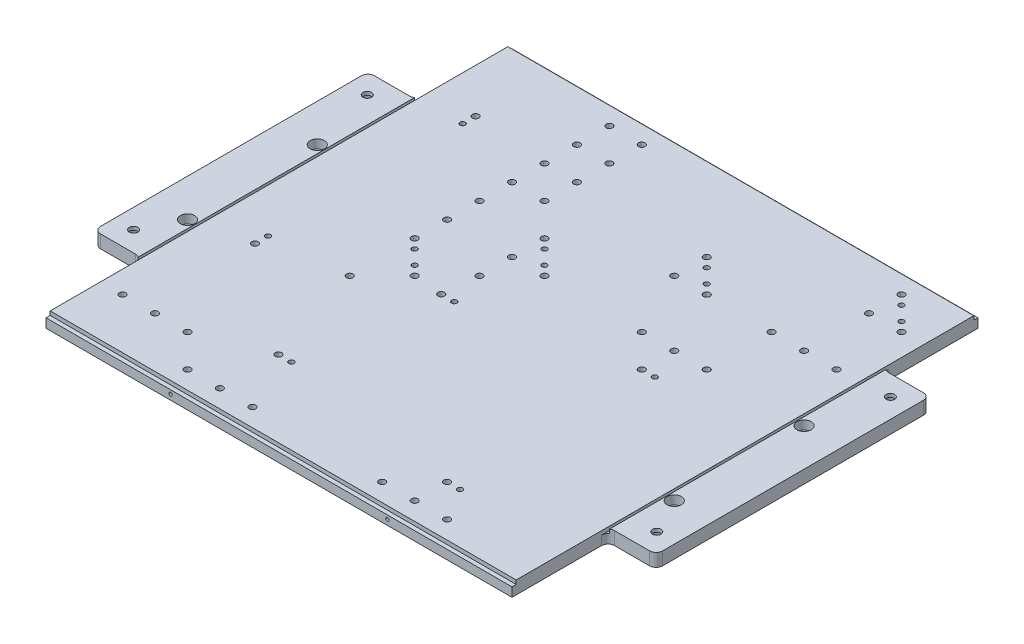
from build123d import *

# Parameters (mm, degrees)
SKETCH_1_W                  = 411
SKETCH_1_H                  = 387
EXTRUDE_1_DEPTH             = 10
HOLE_WIZARD_M6_1_D          = 5
PATTERN_LINEAR_1_COUNT      = 16
PATTERN_LINEAR_1_PITCH      = 25
PATTERN_LINEAR_1_COUNT_DIR2 = 15
PATTERN_LINEAR_1_PITCH_DIR2 = 25
CUT_EXTRUDE_1_DEPTH         = 1521.246679475
SKETCH_7_W                  = 359.002103073
SKETCH_7_H                  = 10
CUT_EXTRUDE_2_DEPTH         = 2
SKETCH_6_W                  = 37
SKETCH_6_H                  = 211
EXTRUDE_2_DEPTH             = 10
HOLE_WIZARD_4_AT_2_COUNT    = 2
HOLE_WIZARD_4_AT_2_PITCH    = 180
HOLE_WIZARD_2_D             = 6.6
HOLE_WIZARD_2_CBORE_D       = 11
HOLE_WIZARD_2_CBORE_DEPTH   = 6.8
FILLET_1_R                  = 5
SKETCH_13_W                 = 2
SKETCH_13_H                 = 221
CUT_EXTRUDE_3_DEPTH         = 3
MIRROR_START                = -18.243069244
MIRROR_1_OUTLINE_R          = 5.5
MIRROR_1_DEPTH              = 10
MIRROR_1_2_OUTLINE_W        = 2
MIRROR_1_2_OUTLINE_H        = 211
MIRROR_1_2_DEPTH            = 7
MIRROR_1_3_OUTLINE_R        = 5.5
MIRROR_1_3_OUTLINE_R_2      = 3.3
MIRROR_1_3_DEPTH            = 3.2
MIRROR_START_2              = -10.943069244
MIRROR_1_4_OUTLINE_R        = 5.5
MIRROR_1_4_OUTLINE_R_2      = 3.3
MIRROR_1_4_DEPTH            = 2.7
FILLET_2_R                  = 5
MM_1_D                      = 4
MM_1_DEPTH                  = 5
MM_1_TIP                    = 1.201721238
SKETCH_21_W                 = 359.002103073
SKETCH_21_H                 = 3.2
CUT_EXTRUDE_4_DEPTH         = 3
SKETCH_27_W                 = 41.507611356
SKETCH_27_H                 = 16.91050833
SKETCH_27_W_2               = 59.033047261
SKETCH_27_W_3               = 46.898939792
SKETCH_27_H_2               = 20.423731845
SKETCH_27_W_4               = 48.421635053
SKETCH_27_H_3               = 17.145848956
SKETCH_27_W_5               = 188.400683749
SKETCH_27_H_4               = 13.273709609
SKETCH_27_W_6               = 112.684721901
SKETCH_27_H_5               = 11.860005057
SKETCH_27_W_7               = 13.604123448
SKETCH_27_H_6               = 18.487654942
SKETCH_27_W_8               = 13.618797305
SKETCH_27_W_9               = 39.068251954
SKETCH_27_H_7               = 62.788262068
SKETCH_27_W_10              = 91.658386013
SKETCH_27_H_8               = 38.021780919
SKETCH_27_W_11              = 15.139084427
SKETCH_27_H_9               = 88.931751365
SKETCH_27_H_10              = 19.101334579
SKETCH_27_W_12              = 12.872846144
SKETCH_27_H_11              = 37.69112722
SKETCH_27_W_13              = 25.127795673
SKETCH_27_H_12              = 295.469278641
SKETCH_27_W_14              = 11.542629068
SKETCH_27_H_13              = 11.212839666
SKETCH_27_W_15              = 13.955770488
SKETCH_27_H_14              = 189.938608596
SKETCH_27_W_16              = 81.343958049
SKETCH_27_H_15              = 11.636862104
SKETCH_27_W_17              = 41.419277235
SKETCH_27_H_16              = 36.742907224
SKETCH_27_W_18              = 39.735429832
SKETCH_27_H_17              = 11.559156978
EXTRUDE_3_DEPTH             = 10
SKETCH_28_W                 = 42.000178388
SKETCH_28_H                 = 16.704616404
SKETCH_28_W_2               = 21.000089194
SKETCH_28_H_2               = 212.387265713
EXTRUDE_4_DEPTH             = 10
SKETCH_29_W                 = 13.644321788
SKETCH_29_H                 = 12.474808491
SKETCH_29_W_2               = 8.284490797
SKETCH_29_H_2               = 7.647222274
SKETCH_29_W_3               = 63.515460672
SKETCH_29_H_3               = 13.700690012
SKETCH_29_W_4               = 63.924431751
SKETCH_29_H_4               = 15.793094903
SKETCH_29_W_5               = 62.420327474
SKETCH_29_W_6               = 60.418413128
SKETCH_29_H_5               = 15.604334822
SKETCH_29_W_7               = 60.104489011
SKETCH_29_W_8               = 13.682181528
SKETCH_29_H_6               = 111.610747838
EXTRUDE_7_DEPTH             = 10
SKETCH_30_W                 = 19.090990176
SKETCH_30_H                 = 209.523617186
SKETCH_30_W_2               = 138.409678779
SKETCH_30_H_2               = 117.409589585
SKETCH_30_W_3               = 63.000267582
SKETCH_30_H_3               = 44.535697431
SKETCH_30_W_4               = 12.409143615
SKETCH_30_H_4               = 11.93186886
SKETCH_30_W_5               = 43.846173029
SKETCH_30_H_5               = 14.820702415
EXTRUDE_9_DEPTH             = 10
HOLE_WIZARD_M6_2_D          = 5
MM_5_D                      = 4
MM_5_DEPTH                  = 5
MM_5_TIP                    = 1.201721238


# Read off the part's stored shape, not the designer's step: 镜向1, M3 螺纹孔, M3 螺纹孔
with BuildPart() as part:
    # 草图1 → 凸台-拉伸1 (new body)
    with BuildSketch(Plane(origin=(-1122.052953715, -8.243069244, -45.053190539), x_dir=(1, 0, 0), z_dir=(0, 1, 0))):
        with Locations((-103.248130707, -365.224508868)):
            Rectangle(SKETCH_1_W, SKETCH_1_H)
    extrude(amount=-EXTRUDE_1_DEPTH)

    # M6 螺纹孔1 (through all)
    with Locations(Plane(origin=(-1037.801084421, -18.243069244, 494.67131833), x_dir=(0, 0, -1), z_dir=(0, -1, 0))):
        with Locations((0, 0)):
            hole_wizard_m6_1 = Hole(HOLE_WIZARD_M6_1_D / 2)

    # 阵列(线性)1: Hole Wizard M6 _1 16 × 15
    with Locations(*[(-i * PATTERN_LINEAR_1_PITCH, 0, -j * PATTERN_LINEAR_1_PITCH_DIR2) for i in range(PATTERN_LINEAR_1_COUNT) for j in range(PATTERN_LINEAR_1_COUNT_DIR2) if (i, j) != (0, 0)]):
        add(hole_wizard_m6_1, mode=Mode.SUBTRACT)

    # 草图5 → 切除-拉伸1 (cut, through all)
    with BuildSketch(Plane(origin=(0, -8.243069244, 0), x_dir=(1, 0, 0), z_dir=(0, 1, 0))):
        Polygon((-1045.801084421, -511.67131833), (-1045.801084421, -152.67131833), (-1404.803187494, -152.67131833), (-1404.803187494, -511.67131833), (-1404.803187494, -513.67131833), (-1430.801084421, -513.67131833), (-1430.801084421, -126.67131833), (-1019.801084421, -126.67131833), (-1019.801084421, -513.67131833), (-1045.801084421, -513.67131833), align=None)
    extrude(amount=-CUT_EXTRUDE_1_DEPTH, mode=Mode.SUBTRACT)

    # 草图7 → 切除-拉伸2 (cut)
    with BuildSketch(Plane.XY.offset(513.67131833)):
        with Locations((-1225.302135958, -13.243069244)):
            Rectangle(SKETCH_7_W, SKETCH_7_H)
    extrude(amount=-CUT_EXTRUDE_2_DEPTH, mode=Mode.SUBTRACT)

    # 草图6 → 凸台-拉伸2 (add)
    with BuildSketch(Plane.XZ.offset(18.243069244)):
        with Locations((-1423.303187494, 332.17131833)):
            Rectangle(SKETCH_6_W, SKETCH_6_H)
    extrude(amount=-EXTRUDE_2_DEPTH)

    # 草图10 → 打孔尺寸(%根据)内六角圆柱头螺钉的类型4 (revolve, cut)
    with BuildSketch(Plane(origin=(-1426.803187494, -18.243069244, 242.17131833), x_dir=(0, 0, -1), z_dir=(1, 0, 0))):
        Polygon((0, 0), (0, 21.732840043), (3.3, 19.75), (3.3, 7.3), (5.5, 7.3), (5.5, 0), align=None)
    hole_wizard_4 = revolve(axis=Axis((-1426.803187494, -24.593069244, 242.17131833), (0, 1, 0)), mode=Mode.SUBTRACT)

    # 打孔尺寸(%根据)内六角圆柱头螺钉的类型4 at 2: 打孔尺寸(%根据)内六角圆柱头螺钉的类型4 ×2
    with Locations(*[(0, 0, i * HOLE_WIZARD_4_AT_2_PITCH) for i in range(1, HOLE_WIZARD_4_AT_2_COUNT)]):
        add(hole_wizard_4, mode=Mode.SUBTRACT)

    # 打孔尺寸(%根据)内六角圆柱头螺钉的类型2 (through all)
    with Locations(Plane(origin=(-1412.801084421, -8.243069244, 294.67131833), x_dir=(0, 0, 1), z_dir=(0, 1, 0))):
        with Locations((0, 0), (100, 0)):
            CounterBoreHole(HOLE_WIZARD_2_D / 2, HOLE_WIZARD_2_CBORE_D / 2, HOLE_WIZARD_2_CBORE_DEPTH)

    # 圆角1
    fillet_1_edges = [part.edges().sort_by_distance(p)[0] for p in [
        (-1441.803187494, -13.243069244, 437.67131833),
        (-1441.803187494, -13.243069244, 226.67131833),
        (-1404.803187494, -13.243069244, 226.67131833),
        (-1404.803187494, -13.243069244, 437.67131833),
    ]]
    fillet(fillet_1_edges, radius=FILLET_1_R)

    # 草图13 → 切除-拉伸3 (cut)
    with BuildSketch(Plane(origin=(0, -8.243069244, 0), x_dir=(1, 0, 0), z_dir=(0, 1, 0))):
        with Locations((-1405.803187494, -332.17131833)):
            Rectangle(SKETCH_13_W, SKETCH_13_H)
    extrude(amount=-CUT_EXTRUDE_3_DEPTH, mode=Mode.SUBTRACT)



with BuildPart() as body_2:
    # 镜向1 outline → 镜向1 (new body)
    with BuildSketch(Plane(origin=(0, 0, 0), x_dir=(1, 0, 0), z_dir=(0, 1, 0)).offset(MIRROR_START)):
        with BuildLine():
            Line((-1043.801084421, -437.67131833), (-1013.801084421, -437.67131833))
            ThreePointArc((-1013.801084421, -437.67131833), (-1010.265550515, -436.206852236), (-1008.801084421, -432.67131833))
            Line((-1008.801084421, -432.67131833), (-1008.801084421, -231.67131833))
            ThreePointArc((-1008.801084421, -231.67131833), (-1010.265550515, -228.135784424), (-1013.801084421, -226.67131833))
            Line((-1013.801084421, -226.67131833), (-1043.801084421, -226.67131833))
            Line((-1043.801084421, -226.67131833), (-1043.801084421, -437.67131833))
        make_face()
        with Locations((-1037.803187494, -394.67131833)):
            Circle(MIRROR_1_OUTLINE_R, mode=Mode.SUBTRACT)
        with Locations((-1023.801084421, -422.17131833)):
            Circle(MIRROR_1_OUTLINE_R, mode=Mode.SUBTRACT)
        with Locations((-1037.803187494, -294.67131833)):
            Circle(MIRROR_1_OUTLINE_R, mode=Mode.SUBTRACT)
        with Locations((-1023.801084421, -242.17131833)):
            Circle(MIRROR_1_OUTLINE_R, mode=Mode.SUBTRACT)
    extrude(amount=MIRROR_1_DEPTH)


with BuildPart() as part_1:
    add(part.part)

    add(body_2.part)  # Mirror 1 2 merges body 2
    # Mirror 1 2 outline → Mirror 1 2 (add)
    with BuildSketch(Plane(origin=(0, 0, 0), x_dir=(1, 0, 0), z_dir=(0, 1, 0)).offset(MIRROR_START)):
        with Locations((-1044.801084421, -332.17131833)):
            Rectangle(MIRROR_1_2_OUTLINE_W, MIRROR_1_2_OUTLINE_H)
    extrude(amount=MIRROR_1_2_DEPTH)

    # Mirror 1 3 outline → Mirror 1 3 (add)
    # profile 1 of 2: a face of its own
    with BuildSketch(Plane(origin=(0, 0, 0), x_dir=(1, 0, 0), z_dir=(0, 1, 0)).offset(MIRROR_START)):
        with Locations((-1037.803187494, -394.67131833)):
            Circle(MIRROR_1_3_OUTLINE_R)
        with Locations((-1037.803187494, -394.67131833)):
            Circle(MIRROR_1_3_OUTLINE_R_2, mode=Mode.SUBTRACT)
    # profile 2 of 2: a face of its own
    with BuildSketch(Plane(origin=(0, 0, 0), x_dir=(1, 0, 0), z_dir=(0, 1, 0)).offset(MIRROR_START)):
        with Locations((-1037.803187494, -294.67131833)):
            Circle(MIRROR_1_3_OUTLINE_R)
        with Locations((-1037.803187494, -294.67131833)):
            Circle(MIRROR_1_3_OUTLINE_R_2, mode=Mode.SUBTRACT)
    extrude(amount=MIRROR_1_3_DEPTH)

    # Mirror 1 4 outline → Mirror 1 4 (add)
    # profile 1 of 2: a face of its own
    with BuildSketch(Plane(origin=(0, 0, 0), x_dir=(1, 0, 0), z_dir=(0, 1, 0)).offset(MIRROR_START_2)):
        with Locations((-1023.801084421, -422.17131833)):
            Circle(MIRROR_1_4_OUTLINE_R)
        with Locations((-1023.801084421, -422.17131833)):
            Circle(MIRROR_1_4_OUTLINE_R_2, mode=Mode.SUBTRACT)
    # profile 2 of 2: a face of its own
    with BuildSketch(Plane(origin=(0, 0, 0), x_dir=(1, 0, 0), z_dir=(0, 1, 0)).offset(MIRROR_START_2)):
        with Locations((-1023.801084421, -242.17131833)):
            Circle(MIRROR_1_4_OUTLINE_R)
        with Locations((-1023.801084421, -242.17131833)):
            Circle(MIRROR_1_4_OUTLINE_R_2, mode=Mode.SUBTRACT)
    extrude(amount=MIRROR_1_4_DEPTH)

    # 圆角2
    # the kernel refuses this fillet: 5 mm, written as the material it adds along each edge
    with BuildSketch(Plane(origin=(-1045.801084421, -18.243069244, 437.67131833), x_dir=(-6.125446816440671e-11, 0, 1.0), z_dir=(0, 1, 0))) as fillet_2_piece_1_section:
        with BuildLine():
            CenterArc((FILLET_2_R, FILLET_2_R), FILLET_2_R, 180.000000004, 90)
            Line((-FILLET_2_R * 6.12544681607e-11, FILLET_2_R), (0, 0))
            Line((0, 0), (FILLET_2_R, 0))
        make_face()
    fillet_2_piece_1 = extrude(amount=7, mode=Mode.PRIVATE)
    fillet_2_piece_1 = split(fillet_2_piece_1, bisect_by=Plane(origin=(-1043.801084421, -14.743069244, 439.02909794), z_dir=(-1, 0, 0)), keep=Keep.TOP, mode=Mode.PRIVATE)
    add(fillet_2_piece_1)
    with BuildSketch(Plane(origin=(-1045.801084421, -18.243069244, 437.67131833), x_dir=(-6.125446816440671e-11, 0, 1.0), z_dir=(0, 1, 0))) as fillet_2_piece_2_section:
        with BuildLine():
            CenterArc((FILLET_2_R, FILLET_2_R), FILLET_2_R, 180.000000004, 90)
            Line((-FILLET_2_R * 6.12544681607e-11, FILLET_2_R), (0, 0))
            Line((0, 0), (FILLET_2_R, 0))
        make_face()
    fillet_2_piece_2 = extrude(amount=7, mode=Mode.PRIVATE)
    fillet_2_piece_2 = split(fillet_2_piece_2, bisect_by=Plane(origin=(-1043.801084421, -14.743069244, 437.883205802), z_dir=(1, 0, 0)), keep=Keep.TOP, mode=Mode.PRIVATE)
    add(fillet_2_piece_2)
    with BuildSketch(Plane(origin=(-1045.801084421, -18.243069244, 437.67131833), x_dir=(-6.125446816440671e-11, 0, 1.0), z_dir=(0, 1, 0))) as fillet_2_piece_3_section:
        with BuildLine():
            CenterArc((FILLET_2_R, FILLET_2_R), FILLET_2_R, 180.000000004, 90)
            Line((-FILLET_2_R * 6.12544681607e-11, FILLET_2_R), (0, 0))
            Line((0, 0), (FILLET_2_R, 0))
        make_face()
    fillet_2_piece_3 = extrude(amount=19.5, mode=Mode.PRIVATE)
    fillet_2_piece_3 = split(fillet_2_piece_3, bisect_by=Plane(origin=(-1042.884026141, -8.243069244, 437.883205802), z_dir=(0, -1, 0)), keep=Keep.TOP, mode=Mode.PRIVATE)
    fillet_2_piece_3 = split(fillet_2_piece_3, bisect_by=Plane(origin=(-1042.884026141, -11.243069244, 437.883205802), z_dir=(0, 1, 0)), keep=Keep.TOP, mode=Mode.PRIVATE)
    fillet_2_piece_3 = split(fillet_2_piece_3, bisect_by=Plane(origin=(-1043.801084421, -9.743069244, 437.883205802), z_dir=(1, 0, 0)), keep=Keep.TOP, mode=Mode.PRIVATE)
    add(fillet_2_piece_3)
    with BuildSketch(Plane(origin=(-1045.801084421, -18.243069244, 226.67131833), x_dir=(-6.125446816440636e-11, 0, -1.0), z_dir=(0, 1, 0))) as fillet_2_piece_4_section:
        with BuildLine():
            CenterArc((FILLET_2_R, -FILLET_2_R), FILLET_2_R, 89.999999996, 90)
            Line((-FILLET_2_R * 6.12487838188e-11, -FILLET_2_R), (0, 0))
            Line((0, 0), (FILLET_2_R, 0))
        make_face()
    fillet_2_piece_4 = extrude(amount=7, mode=Mode.PRIVATE)
    fillet_2_piece_4 = split(fillet_2_piece_4, bisect_by=Plane(origin=(-1043.801084421, -14.743069244, 225.31353872), z_dir=(-1, 0, 0)), keep=Keep.TOP, mode=Mode.PRIVATE)
    add(fillet_2_piece_4)
    with BuildSketch(Plane(origin=(-1045.801084421, -18.243069244, 226.67131833), x_dir=(-6.125446816440636e-11, 0, -1.0), z_dir=(0, 1, 0))) as fillet_2_piece_5_section:
        with BuildLine():
            CenterArc((FILLET_2_R, -FILLET_2_R), FILLET_2_R, 89.999999996, 90)
            Line((-FILLET_2_R * 6.12487838188e-11, -FILLET_2_R), (0, 0))
            Line((0, 0), (FILLET_2_R, 0))
        make_face()
    fillet_2_piece_5 = extrude(amount=7, mode=Mode.PRIVATE)
    fillet_2_piece_5 = split(fillet_2_piece_5, bisect_by=Plane(origin=(-1043.801084421, -14.743069244, 226.459430858), z_dir=(1, 0, 0)), keep=Keep.TOP, mode=Mode.PRIVATE)
    add(fillet_2_piece_5)
    with BuildSketch(Plane(origin=(-1045.801084421, -18.243069244, 226.67131833), x_dir=(-6.125446816440636e-11, 0, -1.0), z_dir=(0, 1, 0))) as fillet_2_piece_6_section:
        with BuildLine():
            CenterArc((FILLET_2_R, -FILLET_2_R), FILLET_2_R, 89.999999996, 90)
            Line((-FILLET_2_R * 6.12487838188e-11, -FILLET_2_R), (0, 0))
            Line((0, 0), (FILLET_2_R, 0))
        make_face()
    fillet_2_piece_6 = extrude(amount=19.5, mode=Mode.PRIVATE)
    fillet_2_piece_6 = split(fillet_2_piece_6, bisect_by=Plane(origin=(-1042.884026141, -8.243069244, 226.459430858), z_dir=(0, -1, 0)), keep=Keep.TOP, mode=Mode.PRIVATE)
    fillet_2_piece_6 = split(fillet_2_piece_6, bisect_by=Plane(origin=(-1042.884026141, -11.243069244, 226.459430858), z_dir=(0, 1, 0)), keep=Keep.TOP, mode=Mode.PRIVATE)
    fillet_2_piece_6 = split(fillet_2_piece_6, bisect_by=Plane(origin=(-1043.801084421, -9.743069244, 226.459430858), z_dir=(1, 0, 0)), keep=Keep.TOP, mode=Mode.PRIVATE)
    add(fillet_2_piece_6)

    # 大小mm 暗销孔1
    with Locations(Plane(origin=(-1080.730016609, -8.243069244, 176.742386142), x_dir=(0, 0, 1), z_dir=(0, 1, 0))):
        with Locations((0, 0), (10.857864376, 10.857864376), (60.857864376, -89.142135624), (50, -100), (110.857864376, -164.142135624), (100, -175), (160.858270185, -214.142541436), (150.000160052, -225.00016005)):
            Hole(MM_1_D / 2, depth=MM_1_DEPTH)
            with Locations((0, 0, -(MM_1_DEPTH + MM_1_TIP / 2))):  # 118° drill point
                Cone(0, MM_1_D / 2, MM_1_TIP, mode=Mode.SUBTRACT)

    # 草图21 → 切除-拉伸4 (cut)
    with BuildSketch(Plane(origin=(0, -8.243069244, 0), x_dir=(1, 0, 0), z_dir=(0, 1, 0))):
        with Locations((-1225.302135958, -154.27131833)):
            Rectangle(SKETCH_21_W, SKETCH_21_H)
        with Locations((-1225.302135958, -510.07131833)):
            Rectangle(SKETCH_21_W, SKETCH_21_H)
    extrude(amount=-CUT_EXTRUDE_4_DEPTH, mode=Mode.SUBTRACT)

    # Hole Wizard M3 outline → Hole Wizard M3 (revolve, cut)
    with BuildSketch(Plane(origin=(-1308.798192024, -14.243069244, 0), x_dir=(1, 0, 0), z_dir=(0, -1, 0))):
        Polygon((1.25, 152.67131833), (1.25, 160.67131833), (0, 161.422394104), (0, 152.67131833), align=None)
    revolve(axis=Axis((-1308.798192024, -14.243069244, 0), (0, 0, 1)), mode=Mode.SUBTRACT)

    # Hole Wizard M3 2 outline → Hole Wizard M3 2 (revolve, cut)
    with BuildSketch(Plane(origin=(-1141.798192024, -14.243069244, 0), x_dir=(1, 0, 0), z_dir=(0, -1, 0))):
        Polygon((1.25, 152.67131833), (1.25, 160.67131833), (0, 161.422394104), (0, 152.67131833), align=None)
    revolve(axis=Axis((-1141.798192024, -14.243069244, 0), (0, 0, 1)), mode=Mode.SUBTRACT)

    # Hole Wizard M3 3 outline → Hole Wizard M3 3 (revolve, cut)
    with BuildSketch(Plane(origin=(-1308.798192024, -14.243069244, 0), x_dir=(1, 0, 0), z_dir=(0, -1, 0))):
        Polygon((0, 502.920242556), (1.25, 503.67131833), (1.25, 511.67131833), (0, 511.67131833), align=None)
    revolve(axis=Axis((-1308.798192024, -14.243069244, 0), (0, 0, 1)), mode=Mode.SUBTRACT)

    # Hole Wizard M3 3 2 outline → Hole Wizard M3 3 2 (revolve, cut)
    with BuildSketch(Plane(origin=(-1141.798192024, -14.243069244, 0), x_dir=(1, 0, 0), z_dir=(0, -1, 0))):
        Polygon((0, 502.920242556), (1.25, 503.67131833), (1.25, 511.67131833), (0, 511.67131833), align=None)
    revolve(axis=Axis((-1141.798192024, -14.243069244, 0), (0, 0, 1)), mode=Mode.SUBTRACT)

    # 草图27 → 凸台-拉伸3 (add, through all)
    with BuildSketch(Plane(origin=(0, -8.243069244, 0), x_dir=(1, 0, 0), z_dir=(0, 1, 0))):
        with Locations((-1199.649282092, -494.994915489)):
            Rectangle(SKETCH_27_W, SKETCH_27_H)
        with Locations((-1079.584672949, -494.994915489)):
            Rectangle(SKETCH_27_W_2, SKETCH_27_H)
        with Locations((-1078.435717972, -289.903916073)):
            Rectangle(SKETCH_27_W_3, SKETCH_27_H_2)
        with Locations((-1196.192270244, -291.542857518)):
            Rectangle(SKETCH_27_W_4, SKETCH_27_H_3)
        with Locations((-1149.186589951, -269.061509581)):
            Rectangle(SKETCH_27_W_5, SKETCH_27_H_4)
        with Locations((-1111.328609027, -219.378743549)):
            Rectangle(SKETCH_27_W_6, SKETCH_27_H_5)
        with Locations((-1137.846545495, -245.017283893)):
            Rectangle(SKETCH_27_W_7, SKETCH_27_H_6)
        with Locations((-1061.795646729, -168.450486538)):
            Rectangle(SKETCH_27_W_8, SKETCH_27_H_5)
        with Locations((-1226.970995264, -193.914615043)):
            Rectangle(SKETCH_27_W_9, SKETCH_27_H_7)
        with Locations((-1150.363077237, -181.531374469)):
            Rectangle(SKETCH_27_W_10, SKETCH_27_H_8)
        with Locations((-1266.269407303, -206.986359692)):
            Rectangle(SKETCH_27_W_11, SKETCH_27_H_9)
        with Locations((-1226.970995264, -241.901568085)):
            Rectangle(SKETCH_27_W_9, SKETCH_27_H_10)
        with Locations((-1289.891778574, -281.270218386)):
            Rectangle(SKETCH_27_W_12, SKETCH_27_H_11)
        with Locations((-1337.252409854, -312.048778062)):
            Rectangle(SKETCH_27_W_13, SKETCH_27_H_12)
        with Locations((-1287.207313057, -319.117980891)):
            Rectangle(SKETCH_27_W_14, SKETCH_27_H_13)
        with Locations((-1239.0327317, -408.480865356)):
            Rectangle(SKETCH_27_W_15, SKETCH_27_H_14)
        with Locations((-1290.987895969, -469.774226773)):
            Rectangle(SKETCH_27_W_16, SKETCH_27_H_15)
        with Locations((-1373.00466654, -434.33970125)):
            Rectangle(SKETCH_27_W_17, SKETCH_27_H_16)
        with Locations((-1373.846590241, -494.545947833)):
            Rectangle(SKETCH_27_W_18, SKETCH_27_H_17)
    extrude(amount=-EXTRUDE_3_DEPTH)

    # 草图28 → 凸台-拉伸4 (add, through all)
    with BuildSketch(Plane(origin=(0, -8.243069244, 0), x_dir=(1, 0, 0), z_dir=(0, 1, 0))):
        with Locations((-1376.359595728, -169.420627076)):
            Rectangle(SKETCH_28_W, SKETCH_28_H)
        with Locations((-1386.859640325, -294.466612731)):
            Rectangle(SKETCH_28_W_2, SKETCH_28_H_2)
    extrude(amount=-EXTRUDE_4_DEPTH)

    # 草图29 → 凸台-拉伸7 (add, through all)
    with BuildSketch(Plane(origin=(0, -8.243069244, 0), x_dir=(1, 0, 0), z_dir=(0, 1, 0))):
        with Locations((-1312.797213292, -345.191502531)):
            Rectangle(SKETCH_29_W, SKETCH_29_H)
        with Locations((-1263.075419887, -344.533272281)):
            Rectangle(SKETCH_29_W_2, SKETCH_29_H_2)
        with Locations((-1287.86164385, -443.714501117)):
            Rectangle(SKETCH_29_W_3, SKETCH_29_H_3)
        with Locations((-1189.293633966, -319.552968558)):
            Rectangle(SKETCH_29_W_4, SKETCH_29_H_4)
        with Locations((-1087.390569234, -319.552968558)):
            Rectangle(SKETCH_29_W_5, SKETCH_29_H_4)
        with Locations((-1187.540624654, -469.686482866)):
            Rectangle(SKETCH_29_W_6, SKETCH_29_H_5)
        with Locations((-1086.232650003, -469.686482866)):
            Rectangle(SKETCH_29_W_7, SKETCH_29_H_5)
        with Locations((-1063.021496261, -394.759472204)):
            Rectangle(SKETCH_29_W_8, SKETCH_29_H_6)
    extrude(amount=-EXTRUDE_7_DEPTH)

    # 草图30 → 凸台-拉伸9 (add, through all)
    with BuildSketch(Plane(origin=(0, -8.243069244, 0), x_dir=(1, 0, 0), z_dir=(0, 1, 0))):
        with Locations((-1362.995902605, -293.512063223)):
            Rectangle(SKETCH_30_W, SKETCH_30_H)
        with Locations((-1151.563186401, -394.45567378)):
            Rectangle(SKETCH_30_W_2, SKETCH_30_H_2)
        with Locations((-1285.200117636, -405.597057874)):
            Rectangle(SKETCH_30_W_3, SKETCH_30_H_3)
        with Locations((-1337.223065867, -493.967460075)):
            Rectangle(SKETCH_30_W_4, SKETCH_30_H_4)
        with Locations((-1275.62307036, -369.929081524)):
            Rectangle(SKETCH_30_W_5, SKETCH_30_H_5)
    extrude(amount=-EXTRUDE_9_DEPTH)

    # M6 螺纹孔2 (through all)
    with Locations(Plane(origin=(-1370.803187494, -8.243069244, 214.67131833), x_dir=(0, 0, 1), z_dir=(0, 1, 0))):
        with Locations((0, 0), (170, 0), (132, 105.502103073), (235, 83.002103073)):
            Hole(HOLE_WIZARD_M6_2_D / 2)

    # 大小mm 暗销孔5
    with Locations(Plane(origin=(-1370.803187494, -8.243069244, 224.67131833), x_dir=(0, 0, 1), z_dir=(0, 1, 0))):
        with Locations((0, 0), (150, 0), (225, 93.002103073), (122, 115.502103073), (245, 243.002103073), (95, 243.002103073)):
            Hole(MM_5_D / 2, depth=MM_5_DEPTH)
            with Locations((0, 0, -(MM_5_DEPTH + MM_5_TIP / 2))):  # 118° drill point
                Cone(0, MM_5_D / 2, MM_5_TIP, mode=Mode.SUBTRACT)


solid = part_1.part
